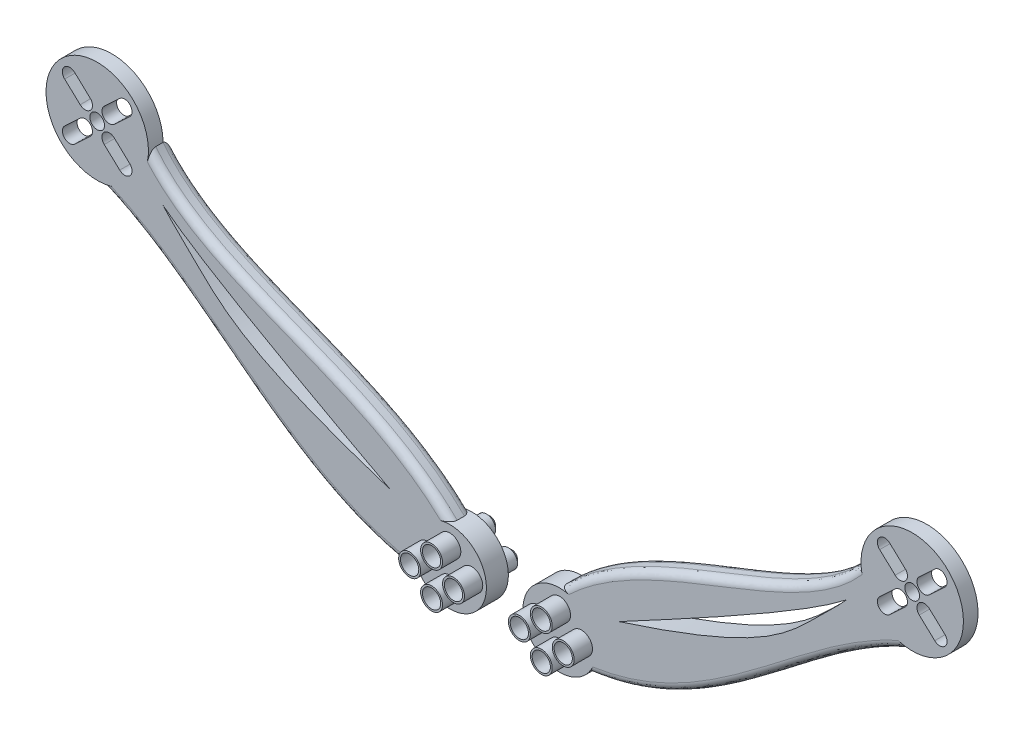
from build123d import *

# Parameters (mm, degrees)
CROQUIS1_R                = 2
SALIENTE_EXTRUIR1_DEPTH   = 6
SALIENTE_EXTRUIR1_2_DEPTH = 6
CROQUIS2_R                = 14
CORTAR_EXTRUIR1_DEPTH     = 2
CROQUIS6_R                = 2.5
SALIENTE_EXTRUIR3_DEPTH   = 5
SALIENTE_EXTRUIR4_START   = 5
CROQUIS7_R                = 3
CROQUIS7_R_2              = 2.5
SALIENTE_EXTRUIR4_DEPTH   = 5
CHAFL_N1_SIZE             = 1
CHAFL_N2_SIZE             = 1
REDONDEO1_R               = 2
REDONDEO2_R               = 2
CORTAR_EXTRUIR2_DEPTH     = 10


with BuildPart() as part:
    # Croquis1 → Saliente-Extruir1 (new body)
    with BuildSketch(Plane.XY):
        with BuildLine():
            ThreePointArc((15, 55), (5.946591805, 40.753142332), (22.689707203, 38.607160011))
            add(Edge.make_bspline(
                [(22.689707203, 38.607160011), (58.877988371, 42.870627436), (81.69768415, 76.745923116), (111.421935907, 88.26583041)],
                knots=[0, 0, 0, 0, 1, 1, 1, 1], degree=3))
            ThreePointArc((111.421935907, 88.26583041), (121.321430843, 112.165325347), (97.421935907, 102.26583041))
            add(Edge.make_bspline(
                [(15, 55), (38.806176658, 78.828363014), (80.220862405, 80.359351949), (97.421935907, 102.26583041)],
                knots=[0, 0, 0, 0, 1, 1, 1, 1], degree=3))
        make_face()
        with Locations((111.421935907, 102.26583041)):
            Circle(CROQUIS1_R, mode=Mode.SUBTRACT)
        with BuildLine():
            Line((113.348112243, 106.797249565), (117.582168959, 110.746312223))
            ThreePointArc((117.582168959, 110.746312223), (120.408882308, 110.647866083), (120.310436168, 107.821152734))
            Line((120.310436168, 107.821152734), (116.076379453, 103.872090077))
            ThreePointArc((116.076379453, 103.872090077), (113.249666103, 103.970536216), (113.348112243, 106.797249565))
        make_face(mode=Mode.SUBTRACT)
        with BuildLine():
            Line((109.495759571, 106.797249565), (105.261702855, 110.746312223))
            ThreePointArc((105.261702855, 110.746312223), (102.434989506, 110.647866083), (102.533435645, 107.821152734))
            Line((102.533435645, 107.821152734), (106.767492361, 103.872090077))
            ThreePointArc((106.767492361, 103.872090077), (109.59420571, 103.970536216), (109.495759571, 106.797249565))
        make_face(mode=Mode.SUBTRACT)
        with BuildLine():
            Line((113.348112243, 97.734411255), (117.582168959, 93.785348598))
            ThreePointArc((117.582168959, 93.785348598), (120.408882308, 93.883794737), (120.310436168, 96.710508086))
            Line((120.310436168, 96.710508086), (116.076379453, 100.659570743))
            ThreePointArc((116.076379453, 100.659570743), (113.249666103, 100.561124604), (113.348112243, 97.734411255))
        make_face(mode=Mode.SUBTRACT)
        with BuildLine():
            Line((109.495759571, 97.734411255), (105.261702855, 93.785348598))
            ThreePointArc((105.261702855, 93.785348598), (102.434989506, 93.883794737), (102.533435645, 96.710508086))
            Line((102.533435645, 96.710508086), (106.767492361, 100.659570743))
            ThreePointArc((106.767492361, 100.659570743), (109.59420571, 100.561124604), (109.495759571, 97.734411255))
        make_face(mode=Mode.SUBTRACT)
    extrude(amount=SALIENTE_EXTRUIR1_DEPTH)


with BuildPart() as body_2:
    # Croquis1 → Saliente-Extruir1 2 (new body)
    with BuildSketch(Plane.XY):
        with BuildLine():
            ThreePointArc((-15, 55), (-5.946591805, 40.753142332), (-22.689707203, 38.607160011))
            add(Edge.make_bspline(
                [(-22.689707203, 38.607160011), (-58.877988371, 42.870627436), (-81.69768415, 76.745923116), (-111.421935907, 88.26583041)],
                knots=[0, 0, 0, 0, 1, 1, 1, 1], degree=3))
            ThreePointArc((-111.421935907, 88.26583041), (-121.321430843, 112.165325347), (-97.421935907, 102.26583041))
            add(Edge.make_bspline(
                [(-15, 55), (-38.806176658, 78.828363014), (-80.220862405, 80.359351949), (-97.421935907, 102.26583041)],
                knots=[0, 0, 0, 0, 1, 1, 1, 1], degree=3))
        make_face()
        with Locations((-111.421935907, 102.26583041)):
            Circle(CROQUIS1_R, mode=Mode.SUBTRACT)
        with BuildLine():
            Line((-109.495759571, 97.734411255), (-105.261702855, 93.785348598))
            ThreePointArc((-105.261702855, 93.785348598), (-102.434989506, 93.883794737), (-102.533435645, 96.710508086))
            Line((-102.533435645, 96.710508086), (-106.767492361, 100.659570743))
            ThreePointArc((-106.767492361, 100.659570743), (-109.59420571, 100.561124604), (-109.495759571, 97.734411255))
        make_face(mode=Mode.SUBTRACT)
        with BuildLine():
            Line((-113.348112243, 97.734411255), (-117.582168959, 93.785348598))
            ThreePointArc((-117.582168959, 93.785348598), (-120.408882308, 93.883794737), (-120.310436168, 96.710508086))
            Line((-120.310436168, 96.710508086), (-116.076379453, 100.659570743))
            ThreePointArc((-116.076379453, 100.659570743), (-113.249666103, 100.561124604), (-113.348112243, 97.734411255))
        make_face(mode=Mode.SUBTRACT)
        with BuildLine():
            Line((-113.348112243, 106.797249565), (-117.582168959, 110.746312223))
            ThreePointArc((-117.582168959, 110.746312223), (-120.408882308, 110.647866083), (-120.310436168, 107.821152734))
            Line((-120.310436168, 107.821152734), (-116.076379453, 103.872090077))
            ThreePointArc((-116.076379453, 103.872090077), (-113.249666103, 103.970536216), (-113.348112243, 106.797249565))
        make_face(mode=Mode.SUBTRACT)
        with BuildLine():
            Line((-109.495759571, 106.797249565), (-105.261702855, 110.746312223))
            ThreePointArc((-105.261702855, 110.746312223), (-102.434989506, 110.647866083), (-102.533435645, 107.821152734))
            Line((-102.533435645, 107.821152734), (-106.767492361, 103.872090077))
            ThreePointArc((-106.767492361, 103.872090077), (-109.59420571, 103.970536216), (-109.495759571, 106.797249565))
        make_face(mode=Mode.SUBTRACT)
    extrude(amount=SALIENTE_EXTRUIR1_2_DEPTH)


with BuildPart() as cortar_extruir1_tool:
    # Croquis2 → Cortar-Extruir1 (new body)
    with BuildSketch(Plane(origin=(0, 0, 0), x_dir=(-1, 0, 0), z_dir=(0, 0, -1))):
        with Locations((111.421935907, 102.26583041)):
            Circle(CROQUIS2_R)
        with Locations((-111.421935907, 102.26583041)):
            Circle(CROQUIS2_R)
    extrude(amount=-CORTAR_EXTRUIR1_DEPTH)


with BuildPart() as part_1:
    add(part.part)

    # Cortar-Extruir1: cut by cortar_extruir1_tool
    add(cortar_extruir1_tool.part, mode=Mode.SUBTRACT)



with BuildPart() as body_2_1:
    add(body_2.part)

    # Cortar-Extruir1: cut by cortar_extruir1_tool
    add(cortar_extruir1_tool.part, mode=Mode.SUBTRACT)


with BuildPart() as part_2:
    add(part_1.part)

    add(body_2_1.part)  # Saliente-Extruir3 merges body 2
    # Croquis6 → Saliente-Extruir3 (add)
    with BuildSketch(Plane.XY):
        with Locations((-15, 50)):
            Circle(CROQUIS6_R)
        with Locations((-21, 45)):
            Circle(CROQUIS6_R)
        with Locations((-15, 40)):
            Circle(CROQUIS6_R)
        with Locations((-9, 45)):
            Circle(CROQUIS6_R)
        with Locations((9, 45)):
            Circle(CROQUIS6_R)
        with Locations((15, 40)):
            Circle(CROQUIS6_R)
        with Locations((21, 45)):
            Circle(CROQUIS6_R)
        with Locations((15, 50)):
            Circle(CROQUIS6_R)
    extrude(amount=-SALIENTE_EXTRUIR3_DEPTH)

    # Croquis7 → Saliente-Extruir4 (add)
    # profile 1 of 8: a face of its own
    with BuildSketch(Plane.XY.offset(6).offset(SALIENTE_EXTRUIR4_START)):
        with Locations((15, 40)):
            Circle(CROQUIS7_R)
        with Locations((15, 40)):
            Circle(CROQUIS7_R_2, mode=Mode.SUBTRACT)
    # profile 2 of 8: a face of its own
    with BuildSketch(Plane.XY.offset(6).offset(SALIENTE_EXTRUIR4_START)):
        with Locations((21, 45)):
            Circle(CROQUIS7_R)
        with Locations((21, 45)):
            Circle(CROQUIS7_R_2, mode=Mode.SUBTRACT)
    # profile 3 of 8: a face of its own
    with BuildSketch(Plane.XY.offset(6).offset(SALIENTE_EXTRUIR4_START)):
        with Locations((9, 45)):
            Circle(CROQUIS7_R)
        with Locations((9, 45)):
            Circle(CROQUIS7_R_2, mode=Mode.SUBTRACT)
    # profile 4 of 8: a face of its own
    with BuildSketch(Plane.XY.offset(6).offset(SALIENTE_EXTRUIR4_START)):
        with Locations((15, 50)):
            Circle(CROQUIS7_R)
        with Locations((15, 50)):
            Circle(CROQUIS7_R_2, mode=Mode.SUBTRACT)
    # profile 5 of 8: a face of its own
    with BuildSketch(Plane.XY.offset(6).offset(SALIENTE_EXTRUIR4_START)):
        with Locations((-15, 40)):
            Circle(CROQUIS7_R)
        with Locations((-15, 40)):
            Circle(CROQUIS7_R_2, mode=Mode.SUBTRACT)
    # profile 6 of 8: a face of its own
    with BuildSketch(Plane.XY.offset(6).offset(SALIENTE_EXTRUIR4_START)):
        with Locations((-9, 45)):
            Circle(CROQUIS7_R)
        with Locations((-9, 45)):
            Circle(CROQUIS7_R_2, mode=Mode.SUBTRACT)
    # profile 7 of 8: a face of its own
    with BuildSketch(Plane.XY.offset(6).offset(SALIENTE_EXTRUIR4_START)):
        with Locations((-21, 45)):
            Circle(CROQUIS7_R)
        with Locations((-21, 45)):
            Circle(CROQUIS7_R_2, mode=Mode.SUBTRACT)
    # profile 8 of 8: a face of its own
    with BuildSketch(Plane.XY.offset(6).offset(SALIENTE_EXTRUIR4_START)):
        with Locations((-15, 50)):
            Circle(CROQUIS7_R)
        with Locations((-15, 50)):
            Circle(CROQUIS7_R_2, mode=Mode.SUBTRACT)
    extrude(amount=-SALIENTE_EXTRUIR4_DEPTH)

    # Chaflán1
    chafl_n1_edges = [part_2.edges().sort_by_distance(p)[0] for p in [
        (6.5, 45, -5),
        (12.5, 50, -5),
        (18.5, 45, -5),
        (12.5, 40, -5),
    ]]
    chamfer(chafl_n1_edges, length=CHAFL_N1_SIZE)

    # Chaflán2
    chafl_n2_edges = [part_2.edges().sort_by_distance(p)[0] for p in [
        (-17.5, 50, -5),
        (-11.5, 45, -5),
        (-23.5, 45, -5),
        (-17.5, 40, -5),
    ]]
    chamfer(chafl_n2_edges, length=CHAFL_N2_SIZE)

    # Redondeo1
    redondeo1_edges = [part_2.edges().sort_by_distance(p)[0] for p in [
        (-58.687881637, 79.353621912, 6),
        (-69.479832584, 60.71533026, 6),
        (-101.52244097, 92.366335474, 0),
        (-69.479832584, 60.71533026, 0),
        (-58.687881637, 79.353621912, 0),
    ]]
    fillet(redondeo1_edges, radius=REDONDEO1_R - 0.0001)  # a hair under: the kernel refuses the full size

    # Redondeo2
    redondeo2_edges = [part_2.edges().sort_by_distance(p)[0] for p in [
        (58.687881637, 79.353621912, 0),
        (69.479832584, 60.71533026, 0),
        (58.687881637, 79.353621912, 6),
        (69.479832584, 60.71533026, 6),
        (101.52244097, 92.366335474, 0),
    ]]
    fillet(redondeo2_edges, radius=REDONDEO2_R - 0.0004)  # a hair under: the kernel refuses the full size

    # Croquis8 → Cortar-Extruir2 (cut)
    with BuildSketch(Plane.XY.offset(6)):
        with BuildLine():
            add(Edge.make_bspline(
                [(-31.208486548, 55.11276628), (-71.834629606, 68.182392001), (-78.775420519, 77.21443731), (-91.203923346, 88.831221291), (-93.428172183, 91.361279306)],
                knots=[0, 0, 0, 0, 0.795771833, 1, 1, 1, 1], degree=3))
            add(Edge.make_bspline(
                [(-93.428172183, 91.361279306), (-82.705749983, 82.978082266), (-58.903491984, 69.932023575), (-31.208486548, 55.11276628)],
                knots=[0, 0, 0, 0, 1, 1, 1, 1], degree=3))
        make_face()
        with BuildLine():
            add(Edge.make_bspline(
                [(31.208486548, 55.11276628), (71.834629606, 68.182392001), (78.775420519, 77.21443731), (91.203923346, 88.831221291), (93.428172183, 91.361279306)],
                knots=[0, 0, 0, 0, 0.795771833, 1, 1, 1, 1], degree=3))
            add(Edge.make_bspline(
                [(93.428172183, 91.361279306), (82.705749983, 82.978082266), (58.903491984, 69.932023575), (31.208486548, 55.11276628)],
                knots=[0, 0, 0, 0, 1, 1, 1, 1], degree=3))
        make_face()
    extrude(amount=-CORTAR_EXTRUIR2_DEPTH, mode=Mode.SUBTRACT)


solid = part_2.part
